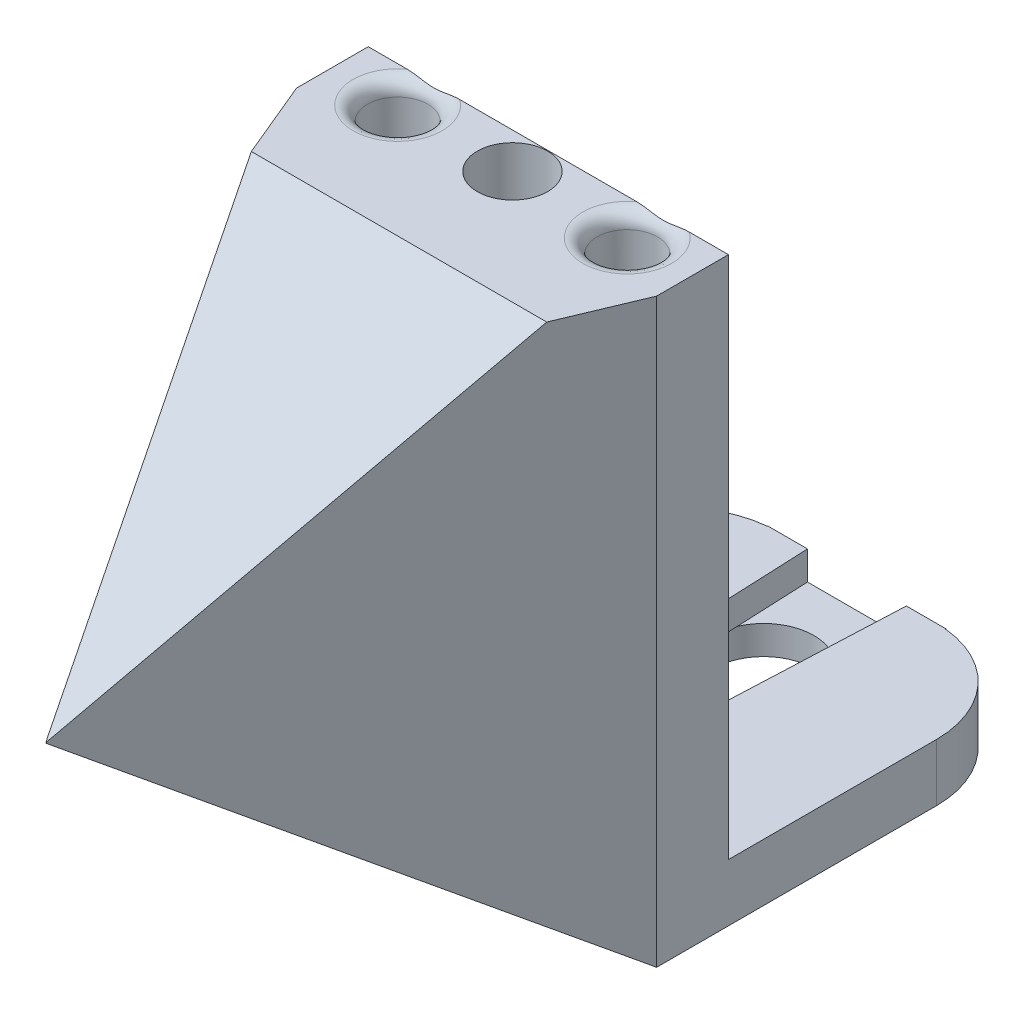
from build123d import *
from OCP.BRepFilletAPI import BRepFilletAPI_MakeChamfer

# Parameters (mm, degrees)
SKETCH4_W                = 12.46
SKETCH4_H                = 17.25
BOSS_EXTRUDE3_DEPTH      = 6
BOSS_EXTRUDE6_DEPTH      = 7.3
BOSS_EXTRUDE6_DEPTH_BACK = 17.25
SKETCH8_R                = 12.546781182
SKETCH8_R_2              = 11.15
BOSS_EXTRUDE4_DEPTH      = 17.25
SKETCH6_R                = 2
CUT_EXTRUDE1_DEPTH       = 5
CHAMFER1_SIZE            = 0.5
CHAMFER1_SIZE_2          = 0.866025404
SKETCH10_W               = 12.46
SKETCH10_H               = 23.7
CUT_EXTRUDE3_DEPTH       = 17.25
CUT_EXTRUDE4_REACH       = 43.938
SKETCH11_W               = 5
SKETCH11_H               = 3
BOSS_EXTRUDE7_START      = -7.3
BOSS_EXTRUDE7_DEPTH      = 7.3
BOSS_EXTRUDE9_START      = 10
BOSS_EXTRUDE9_DEPTH      = 10
BOSS_EXTRUDE10_DEPTH     = 25.093562364
SKETCH18_W               = 21.5
SKETCH18_H               = 12.438292938
CUT_EXTRUDE5_DEPTH       = 2
CUT_EXTRUDE6_DEPTH       = 58.154608998
CUT_EXTRUDE6_DEPTH_BACK  = 58.154608998
SKETCH19_R               = 3.5
FILLET1_R                = 7
CUT_EXTRUDE7_DEPTH       = 55.97840444
CUT_EXTRUDE7_DEPTH_BACK  = 55.97840444
SKETCH20_W               = 25.093562364
SKETCH20_H               = 36.096781182
BOSS_EXTRUDE11_DEPTH     = 44.5
CUT_EXTRUDE8_DEPTH       = 40.401576339
CUT_EXTRUDE8_DEPTH_BACK  = 40.401576339
CUT_EXTRUDE9_DEPTH       = 40.401576339
SKETCH24_R               = 6.5
BOSS_EXTRUDE12_DEPTH     = 5
SKETCH25_R               = 6.075
BOSS_EXTRUDE13_DEPTH     = 5
FILLET2_R                = 1
BOSS_EXTRUDE14_DEPTH     = 2
CUT_EXTRUDE10_REACH      = 57.104
SKETCH27_R               = 0.75
CUT_EXTRUDE11_DEPTH      = 45.983908275
SKETCH29_R               = 2.1
SKETCH29_R_2             = 2.45
CUT_EXTRUDE12_DEPTH      = 7
FILLET3_R                = 10
FILLET4_R                = 1


# Some blends are built 0.0001 mm under size
with BuildPart() as part:
    # Sketch4 → Boss-Extrude3 (new body)
    with BuildSketch(Plane.XY):
        with Locations((0, -1.35)):
            Rectangle(SKETCH4_W, SKETCH4_H)
    extrude(amount=BOSS_EXTRUDE3_DEPTH)



with BuildPart() as body_2:
    # Sketch8 → Boss-Extrude6 (new, two sides: drawn at the far end of the back side and taken through both)
    with BuildSketch(Plane(origin=(0, -9.975, 0), x_dir=(-1, 0, 0), z_dir=(0, -1, 0)).offset(-BOSS_EXTRUDE6_DEPTH_BACK)):
        with Locations(Location((0, -23.55, 0), (0, 0, 90))):
            Circle(SKETCH8_R)
        with Locations(Location((0, -23.55, 0), (0, 0, 90))):
            Circle(SKETCH8_R_2, mode=Mode.SUBTRACT)
    extrude(amount=BOSS_EXTRUDE6_DEPTH + BOSS_EXTRUDE6_DEPTH_BACK)


with BuildPart() as part_1:
    add(part.part)

    add(body_2.part)  # Boss-Extrude4 merges body 2
    # Sketch5 → Boss-Extrude4 (add)
    with BuildSketch(Plane(origin=(0, 7.275, 0), x_dir=(1, 0, 0), z_dir=(0, 1, 0))):
        with BuildLine():
            Line((12.546781182, -23.55), (12.546781182, 0))
            Line((12.546781182, 0), (6.23, 0))
            Line((6.23, 0), (6.23, -29.7))
            Line((6.23, -29.7), (-6.23, -29.7))
            Line((-6.23, -29.7), (-6.23, 0))
            Line((-6.23, 0), (-12.546781182, 0))
            Line((-12.546781182, 0), (-12.546781182, -23.55))
            ThreePointArc((-12.546781182, -23.55), (0, -36.096781182), (12.546781182, -23.55))
        make_face()
    extrude(amount=-BOSS_EXTRUDE4_DEPTH)

    # Sketch6 → Cut-Extrude1 (cut)
    with BuildSketch(Plane(origin=(0, 7.275, 0), x_dir=(1, 0, 0), z_dir=(0, 1, 0))):
        with Locations(Location((0, -3.5, 0), (0, 0, 270))):
            Circle(SKETCH6_R)
        with Locations(Location((0, -32.2, 0), (0, 0, 270))):
            Circle(SKETCH6_R)
    extrude(amount=-CUT_EXTRUDE1_DEPTH, mode=Mode.SUBTRACT)

    # Chamfer1
    chamfer1_edges_1 = [part_1.edges().sort_by_distance(p)[0] for p in [
        (0, 7.275, 1.5),
    ]]
    chamfer1_side_1 = [part_1.faces().sort_by_distance(p)[0] for p in [
        (0, 7.275, 1.49),
    ]]
    chamfer1_edges_2 = [part_1.edges().sort_by_distance(p)[0] for p in [
        (0, 7.275, 30.2),
    ]]
    chamfer1_side_2 = [part_1.faces().sort_by_distance(p)[0] for p in [
        (0, 7.275, 30.19),
    ]]
    chamfer1 = BRepFilletAPI_MakeChamfer(part_1.part.solid().wrapped)
    for e in chamfer1_edges_1:
        chamfer1.Add(CHAMFER1_SIZE - 0.0001, CHAMFER1_SIZE_2 - 0.0001, e.wrapped, chamfer1_side_1[0].wrapped)
    for e in chamfer1_edges_2:
        chamfer1.Add(CHAMFER1_SIZE - 0.0001, CHAMFER1_SIZE_2 - 0.0001, e.wrapped, chamfer1_side_2[0].wrapped)
    add(Compound.cast(chamfer1.Shape()), mode=Mode.REPLACE)  # a hair under: the kernel refuses the full size

    # Sketch10 → Cut-Extrude3 (cut)
    with BuildSketch(Plane(origin=(0, 7.275, 0), x_dir=(1, 0, 0), z_dir=(0, 1, 0))):
        with Locations((0, -17.85)):
            Rectangle(SKETCH10_W, SKETCH10_H)
    extrude(amount=-CUT_EXTRUDE3_DEPTH, mode=Mode.SUBTRACT)

    # Sketch11 → Cut-Extrude4 (cut, up to next)
    with BuildSketch(Plane.XY.offset(36.096781182), mode=Mode.PRIVATE) as cut_extrude4_sk1:
        with Locations((0, -8.475)):
            Rectangle(SKETCH11_W, SKETCH11_H)
    cut_extrude4_tool1 = extrude(cut_extrude4_sk1.sketch, amount=-CUT_EXTRUDE4_REACH, mode=Mode.PRIVATE) & part_1.part
    add(cut_extrude4_tool1.solids().sort_by_distance((0, -8.475, 36.096781))[0], mode=Mode.SUBTRACT)

    # Sketch13 → Boss-Extrude7 (add)
    with BuildSketch(Plane.XZ.offset(17.275).offset(BOSS_EXTRUDE7_START)):
        with BuildLine():
            Line((-12.546781182, 23.55), (-12.546781182, 0))
            Line((-12.546781182, 0), (12.546781182, 0))
            Line((12.546781182, 0), (12.546781182, 23.55))
            ThreePointArc((12.546781182, 23.55), (0, 11.003218818), (-12.546781182, 23.55))
        make_face()
    extrude(amount=BOSS_EXTRUDE7_DEPTH)

    # Sketch15 → Boss-Extrude9 (add)
    with BuildSketch(Plane(origin=(0, 7.275, 0), x_dir=(1, 0, 0), z_dir=(0, 1, 0)).offset(BOSS_EXTRUDE9_START)):
        with BuildLine():
            Line((-12.546781182, 0), (12.546781182, 0))
            Line((12.546781182, 0), (12.546781182, -23.55))
            ThreePointArc((12.546781182, -23.55), (0, -36.096781182), (-12.546781182, -23.55))
            Line((-12.546781182, -23.55), (-12.546781182, 0))
        make_face()
        with BuildLine():
            Line((-6.23, -0.8), (6.23, -0.8))
            Line((6.23, -0.8), (6.23, -33.5))
            ThreePointArc((6.23, -33.5), (5.937106781, -34.207106781), (5.23, -34.5))
            Line((5.23, -34.5), (-5.23, -34.5))
            ThreePointArc((-5.23, -34.5), (-5.937106781, -34.207106781), (-6.23, -33.5))
            Line((-6.23, -33.5), (-6.23, -0.8))
        make_face(mode=Mode.SUBTRACT)
    extrude(amount=-BOSS_EXTRUDE9_DEPTH)

    # Sketch17 → Boss-Extrude10 (add)
    with BuildSketch(Plane(origin=(-12.546781182, 4.728218818, 0), x_dir=(0, -1, 0), z_dir=(1, 0, 0))):
        Polygon((26.978218818, 26.5), (26.978218818, 0), (-17.521781182, 0), (-17.521781182, 26.5), (-13.521781182, 26.5), (-13.521781182, 5), (22.978218818, 5), (22.978218818, 26.5), align=None)
    extrude(amount=BOSS_EXTRUDE10_DEPTH)

    # Sketch18 → Cut-Extrude5 (cut)
    with BuildSketch(Plane.ZX.offset(-18.25)):
        with Locations((-15.75, 0)):
            Rectangle(SKETCH18_W, SKETCH18_H)
    extrude(amount=-CUT_EXTRUDE5_DEPTH, mode=Mode.SUBTRACT)

    # Sketch19 → Cut-Extrude6 (cut, two sides: drawn at the far end of the back side and taken through both)
    with BuildSketch(Plane.ZX.offset(-20.25).offset(-CUT_EXTRUDE6_DEPTH_BACK)):
        with Locations((-20, 0)):
            Circle(SKETCH19_R)
    extrude(amount=CUT_EXTRUDE6_DEPTH + CUT_EXTRUDE6_DEPTH_BACK, mode=Mode.SUBTRACT)

    # Fillet1
    fillet1_edges = [part_1.edges().sort_by_distance(p)[0] for p in [
        (12.546781182, -20.25, -26.5),
        (-12.546781182, -20.25, -26.5),
        (-12.546781182, 20.25, -26.5),
        (12.546781182, 20.25, -26.5),
    ]]
    fillet(fillet1_edges, radius=FILLET1_R)

    # Sketch20 → Cut-Extrude7 (cut, two sides: drawn at the far end of the back side and taken through both)
    with BuildSketch(Plane(origin=(0, 17.275, 0), x_dir=(1, 0, 0), z_dir=(0, 1, 0)).offset(-CUT_EXTRUDE7_DEPTH_BACK)):
        with Locations((0, -18.048390591)):
            Rectangle(SKETCH20_W, SKETCH20_H)
    extrude(amount=CUT_EXTRUDE7_DEPTH + CUT_EXTRUDE7_DEPTH_BACK, mode=Mode.SUBTRACT)

    # Sketch21 → Boss-Extrude11 (add)
    with BuildSketch(Plane(origin=(0, 22.25, 0), x_dir=(1, 0, 0), z_dir=(0, 1, 0))):
        Polygon((12.546781182, 0), (-0.025415104, -30), (-12.546781182, 0), align=None)
    extrude(amount=-BOSS_EXTRUDE11_DEPTH)

    # Sketch22 → Cut-Extrude8 (cut, two sides: drawn at the far end of the back side and taken through both)
    with BuildSketch(Plane(origin=(0, 0, 0), x_dir=(0, 0, -1), z_dir=(1, 0, 0)).offset(-CUT_EXTRUDE8_DEPTH_BACK)):
        Polygon((0, 22.25), (-30, 0.01), (-30, 22.25), align=None)
        Polygon((0, -22.25), (-30, -22.25), (-30, -0.01), align=None)
    extrude(amount=CUT_EXTRUDE8_DEPTH + CUT_EXTRUDE8_DEPTH_BACK, mode=Mode.SUBTRACT)

    # Sketch23 → Cut-Extrude9 (cut, through all)
    with BuildSketch(Plane(origin=(0, 0, 0), x_dir=(-1, 0, 0), z_dir=(0, 0, -1))):
        Polygon((12.546781182, 18.25), (0, 0), (12.546781182, -22.25), align=None)
    extrude(amount=-CUT_EXTRUDE9_DEPTH, mode=Mode.SUBTRACT)

    # Sketch24 → Boss-Extrude12 (add)
    with BuildSketch(Plane(origin=(0, 22.25, 0), x_dir=(1, 0, 0), z_dir=(0, 1, 0))):
        with Locations(Location((0, 20, 0), (0, 0, 270))):
            Circle(SKETCH24_R)
    extrude(amount=-BOSS_EXTRUDE12_DEPTH)

    # Sketch25 → Boss-Extrude13 (add)
    with BuildSketch(Plane.XZ.offset(-17.25)):
        with Locations(Location((0, -20, 0), (0, 0, 270))):
            Circle(SKETCH25_R)
    extrude(amount=BOSS_EXTRUDE13_DEPTH)

    # Fillet2
    fillet2_edges = [part_1.edges().sort_by_distance(p)[0] for p in [
        (0, 12.25, -13.925),
    ]]
    fillet(fillet2_edges, radius=FILLET2_R)

    # Sketch26 → Boss-Extrude14 (add)
    with BuildSketch(Plane(origin=(0, -20.25, 0), x_dir=(1, 0, 0), z_dir=(0, 1, 0))):
        Polygon((-6.219146469, 5), (-2.5, 5), (-3.1585, 20), (-3.44385, 26.5), (-6.219146469, 26.5), align=None)
        Polygon((3.1585, 20), (3.44385, 26.5), (6.219146469, 26.5), (6.219146469, 5), (2.5, 5), align=None)
    extrude(amount=BOSS_EXTRUDE14_DEPTH)

    # Sketch27 → Cut-Extrude10 (cut, up to next)
    with BuildSketch(Plane.XZ.offset(22.25), mode=Mode.PRIVATE) as cut_extrude10_sk1:
        with Locations(Location((0, -10, 0), (0, 0, 270))):
            Circle(SKETCH27_R)
    cut_extrude10_tool1 = extrude(cut_extrude10_sk1.sketch, amount=-CUT_EXTRUDE10_REACH, mode=Mode.PRIVATE) & part_1.part
    # Sketch27 → Cut-Extrude10 (cut, up to next)
    with BuildSketch(Plane.XZ.offset(22.25), mode=Mode.PRIVATE) as cut_extrude10_sk2:
        with Locations(Location((0, -7.5, 0), (0, 0, 270))):
            Circle(SKETCH27_R)
    cut_extrude10_tool2 = extrude(cut_extrude10_sk2.sketch, amount=-CUT_EXTRUDE10_REACH, mode=Mode.PRIVATE) & part_1.part
    # Sketch27 → Cut-Extrude10 (cut, up to next)
    with BuildSketch(Plane.XZ.offset(22.25), mode=Mode.PRIVATE) as cut_extrude10_sk3:
        with Locations(Location((0, -12.5, 0), (0, 0, 270))):
            Circle(SKETCH27_R)
    cut_extrude10_tool3 = extrude(cut_extrude10_sk3.sketch, amount=-CUT_EXTRUDE10_REACH, mode=Mode.PRIVATE) & part_1.part
    add(cut_extrude10_tool1.solids().sort_by_distance((0, -22.25, -10))[0], mode=Mode.SUBTRACT)
    add(cut_extrude10_tool2.solids().sort_by_distance((0, -22.25, -7.5))[0], mode=Mode.SUBTRACT)
    add(cut_extrude10_tool3.solids().sort_by_distance((0, -22.25, -12.5))[0], mode=Mode.SUBTRACT)

    # Sketch28 → Cut-Extrude11 (cut, through all)
    with BuildSketch(Plane(origin=(12.546781182, 0, 0), x_dir=(0, 0, -1), z_dir=(1, 0, 0))):
        Polygon((5, 18.25), (-20.685656294, 18.25), (-20.685656294, 31.083718117), (38.29343765, 31.083718117), (38.29343765, 6.428054208), (5, 6.428054208), align=None)
    extrude(amount=-CUT_EXTRUDE11_DEPTH, mode=Mode.SUBTRACT)

    # Sketch29 → Cut-Extrude12 (cut)
    with BuildSketch(Plane(origin=(0, 18.25, 0), x_dir=(1, 0, 0), z_dir=(0, 1, 0))):
        with Locations(Location((-8, 2.5, 0), (0, 0, 270))):
            Circle(SKETCH29_R)
        with Locations(Location((0, 2.5, 0), (0, 0, 270))):
            Circle(SKETCH29_R_2)
        with Locations(Location((8, 2.5, 0), (0, 0, 270))):
            Circle(SKETCH29_R)
    extrude(amount=-CUT_EXTRUDE12_DEPTH, mode=Mode.SUBTRACT)

    # Fillet3
    # the kernel refuses this fillet: 10 mm, written as the material it adds along each edge
    with BuildSketch(Plane(origin=(-26.70992984, 38.851097546, 0), x_dir=(-0.8240439018220859, -0.566525946334175, 0), z_dir=(0.5665259463341751, -0.824043901822086, 0))) as fillet3_piece_1_section:
        with BuildLine():
            CenterArc((FILLET3_R, -FILLET3_R), FILLET3_R, 90, 90)
            Line((0, -FILLET3_R), (0, 0))
            Line((0, 0), (FILLET3_R, 0))
        make_face()
    fillet3_piece_1 = extrude(amount=72.146878291, mode=Mode.PRIVATE)
    fillet3_piece_1 = split(fillet3_piece_1, bisect_by=Plane(origin=(-10.851908464, 5.541742766, 4.060753532), z_dir=(0.9228434094782519, 0, -0.38517533875178916)), keep=Keep.TOP, mode=Mode.PRIVATE)
    fillet3_piece_1 = split(fillet3_piece_1, bisect_by=Plane(origin=(0.82769932, 1.467811513, 2.201310623), z_dir=(-0.8710538597344621, 0.49118751352380285, 0)), keep=Keep.TOP, mode=Mode.PRIVATE)
    add(fillet3_piece_1)
    with BuildSketch(Plane(origin=(12.279687838, 21.776346493, 0), x_dir=(-0.8710538597344621, 0.4911875135238028, 0), z_dir=(-0.49118751352380285, -0.8710538597344621, 0))) as fillet3_piece_2_section:
        with BuildLine():
            CenterArc((FILLET3_R, -FILLET3_R), FILLET3_R, 90, 90)
            Line((0, -FILLET3_R), (0, 0))
            Line((0, 0), (FILLET3_R, 0))
        make_face()
    fillet3_piece_2 = extrude(amount=75.543770631, mode=Mode.PRIVATE)
    fillet3_piece_2 = split(fillet3_piece_2, bisect_by=Plane(origin=(-12.546781182, -7.723342909, 2.248116877), z_dir=(1, 0, 0)), keep=Keep.TOP, mode=Mode.PRIVATE)
    fillet3_piece_2 = split(fillet3_piece_2, bisect_by=Plane(origin=(1.437353681, -2.090711896, 2.248116877), z_dir=(-0.8240439018220859, -0.566525946334175, 0)), keep=Keep.TOP, mode=Mode.PRIVATE)
    fillet3_piece_2 = split(fillet3_piece_2, bisect_by=Plane(origin=(-6.755625418, -16.022426329, 8.400504052), z_dir=(0, 0.8033294415309644, -0.5955348926549551)), keep=Keep.TOP, mode=Mode.PRIVATE)
    add(fillet3_piece_2)

    # Fillet4
    # the kernel refuses this fillet: 1 mm, written as the material it takes off along each edge
    with BuildSketch(Plane(origin=(-8, 18.25, -2.5), x_dir=(0, 0, 1), z_dir=(-1, 0, 0))) as fillet4_piece_1:
        with BuildLine():
            CenterArc((2.1 + FILLET4_R, -FILLET4_R), FILLET4_R, 90, 90)
            Line((2.1, -FILLET4_R), (2.1, 0))
            Line((2.1, 0), (2.1 + FILLET4_R, 0))
        make_face()
    revolve(axis=Axis((-8, 18.25, -2.5), (0, 1, 0)), mode=Mode.SUBTRACT)
    with BuildSketch(Plane(origin=(8, 18.25, -2.5), x_dir=(0, 0, 1), z_dir=(-1, 0, 0))) as fillet4_piece_2:
        with BuildLine():
            CenterArc((2.1 + FILLET4_R, -FILLET4_R), FILLET4_R, 90, 90)
            Line((2.1, -FILLET4_R), (2.1, 0))
            Line((2.1, 0), (2.1 + FILLET4_R, 0))
        make_face()
    revolve(axis=Axis((8, 18.25, -2.5), (0, 1, 0)), mode=Mode.SUBTRACT)


solid = part_1.part
